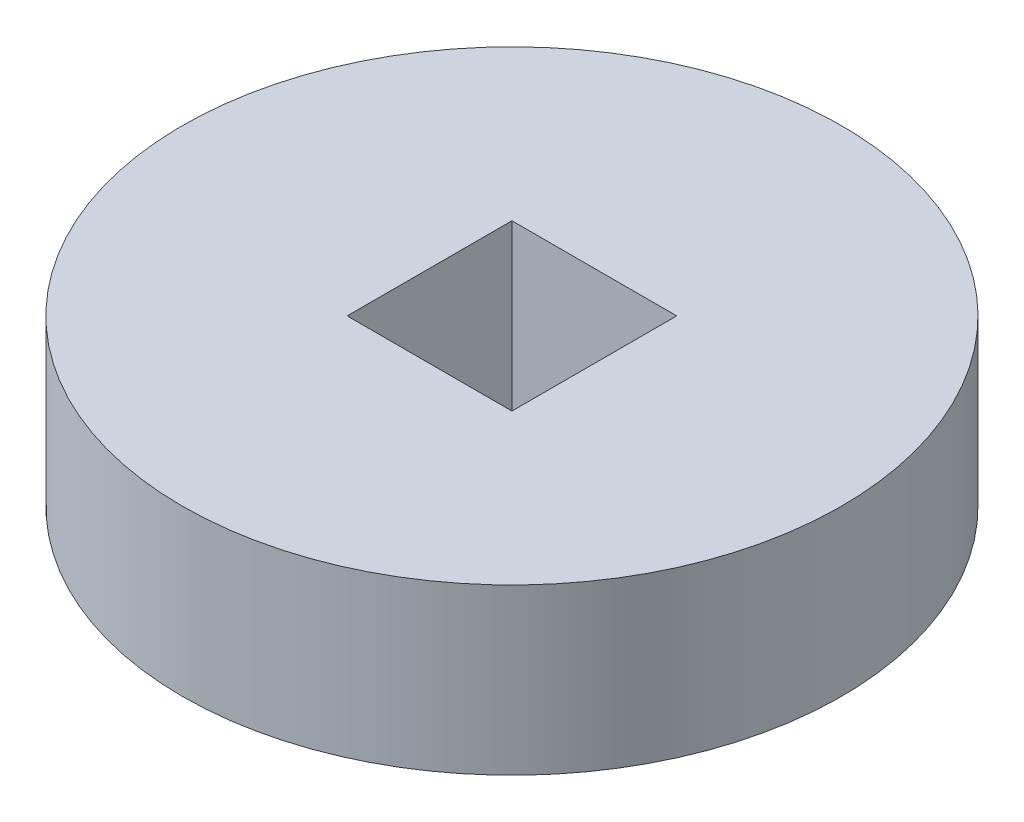
from build123d import *

# Parameters (mm, degrees)
BELT_PULLEY_R       = 12.7
BELT_PULLEY_W       = 6.35
BELT_PULLEY_H       = 6.35
BOSS_EXTRUDE1_DEPTH = 6.35


with BuildPart() as part:
    # Belt Pulley → Boss-Extrude1 (new body)
    with BuildSketch(Plane(origin=(0, 0, 0), x_dir=(1, 0, 0), z_dir=(0, 1, 0))):
        Circle(BELT_PULLEY_R)
        Rectangle(BELT_PULLEY_W, BELT_PULLEY_H, mode=Mode.SUBTRACT)
    extrude(amount=BOSS_EXTRUDE1_DEPTH)


solid = part.part
